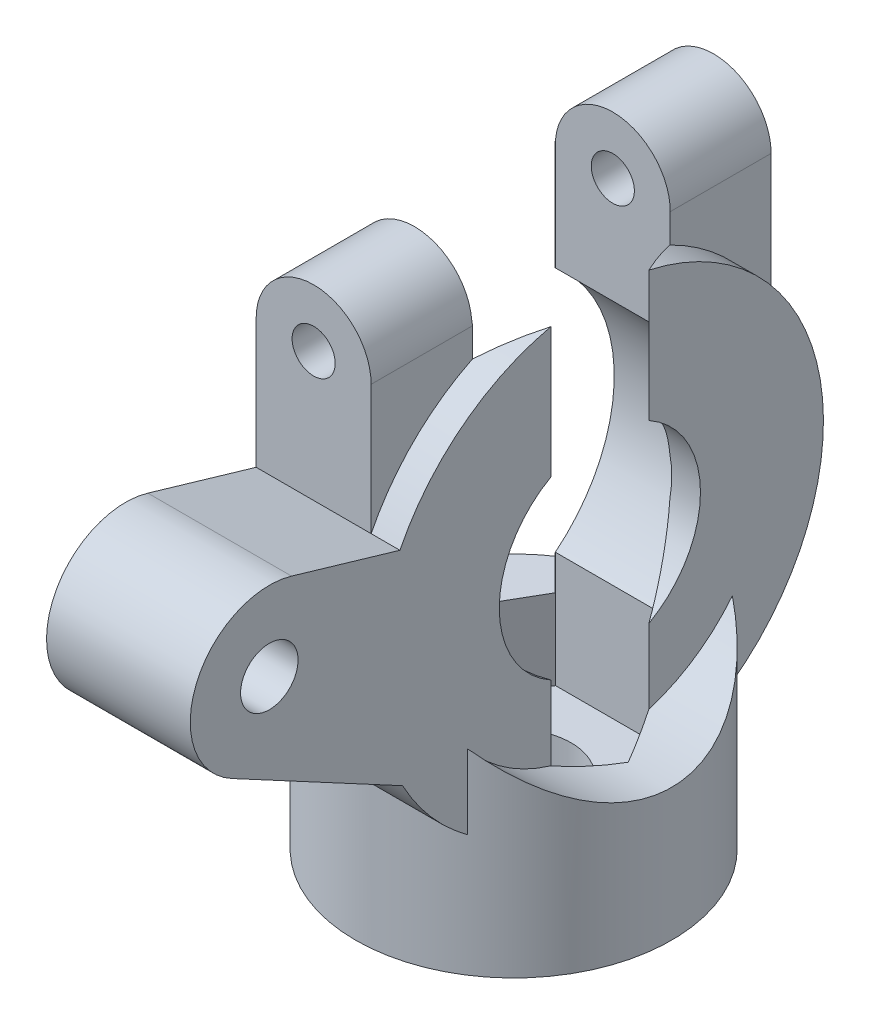
from build123d import *
from build123d.topology import SkipClean

# Parameters (mm, degrees)
SKETCH1_R               = 11
SKETCH1_R_2             = 4
BOSS_EXTRUDE1_DEPTH     = 10
SKETCH3_R               = 15.556349186
SKETCH3_R_2             = 11
BOSS_EXTRUDE2_DEPTH     = 4
CUT_EXTRUDE1_DEPTH      = 33.68393631
CUT_EXTRUDE1_DEPTH_BACK = 5.6
BOSS_EXTRUDE4_DEPTH     = 10
BOSS_EXTRUDE3_DEPTH     = 8
BOSS_EXTRUDE5_START     = 4
SKETCH3_2_R             = 15.556349186
SKETCH3_2_R_2           = 11
BOSS_EXTRUDE5_DEPTH     = 2
CUT_EXTRUDE2_DEPTH      = 37.349590584
CUT_EXTRUDE2_DEPTH_BACK = 5.6
CUT_EXTRUDE3_DEPTH      = 47.993816701
CUT_EXTRUDE3_DEPTH_BACK = 47.993816701
SKETCH13_R              = 7
CUT_EXTRUDE5_DEPTH      = 52.642447787
CUT_EXTRUDE5_DEPTH_BACK = 52.642447787
SKETCH14_R              = 1.5
SKETCH15_R              = 11.789942891
CUT_EXTRUDE6_DEPTH      = 8
BOSS_EXTRUDE6_REACH     = 48.308
SKETCH16_R              = 2


with BuildPart() as part:
    # Sketch1 → Boss-Extrude1 (new body)
    with BuildSketch(Plane(origin=(0, 0, 0), x_dir=(1, 0, 0), z_dir=(0, 1, 0))):
        with Locations(Location((0, 0, 0), (0, 0, 270))):
            Circle(SKETCH1_R)
        with Locations(Location((0, 0, 0), (0, 0, 270))):
            Circle(SKETCH1_R_2, mode=Mode.SUBTRACT)
    extrude(amount=BOSS_EXTRUDE1_DEPTH)

    # Sketch3 → Boss-Extrude2 (add, symmetric)
    with BuildSketch(Plane(origin=(0, 0, 0), x_dir=(0, 0, -1), z_dir=(1, 0, 0))):
        with Locations((0, 21)):
            Circle(SKETCH3_R)
        with Locations(Location((0, 21, 0), (0, 0, 270))):
            Circle(SKETCH3_R_2, mode=Mode.SUBTRACT)
    extrude(amount=BOSS_EXTRUDE2_DEPTH, both=True)

    # Sketch2 → Cut-Extrude1 (cut, two sides: drawn at the far end of the back side and taken through both)
    with BuildSketch(Plane(origin=(0, 10, 0), x_dir=(1, 0, 0), z_dir=(0, 1, 0)).offset(-CUT_EXTRUDE1_DEPTH_BACK)):
        Polygon((3.983716857, 6.9), (-3.983716857, 6.9), (-7.967433715, 0), (-3.983716857, -6.9), (3.983716857, -6.9), (7.967433715, 0), align=None)
    extrude(amount=CUT_EXTRUDE1_DEPTH + CUT_EXTRUDE1_DEPTH_BACK, mode=Mode.SUBTRACT)

    # Sketch9 → Boss-Extrude4 (add)
    with BuildSketch(Plane(origin=(0, 10, 0), x_dir=(1, 0, 0), z_dir=(0, 1, 0))):
        with BuildLine():
            ThreePointArc((4, -10.246950766), (11, 0), (4, 10.246950766))
            Line((4, 10.246950766), (4, 6.87179677))
            Line((4, 6.87179677), (7.967433715, 0))
            Line((7.967433715, 0), (4, -6.87179677))
            Line((4, -6.87179677), (4, -10.246950766))
        make_face()
    extrude(amount=BOSS_EXTRUDE4_DEPTH)

    # Sketch4 → Boss-Extrude3 (add)
    with BuildSketch(Plane(origin=(4, 0, 0), x_dir=(0, 0, -1), z_dir=(1, 0, 0))):
        with BuildLine():
            Line((-6.87179677, 34.956303563), (-6.87179677, 40.956303563))
            Line((-6.87179677, 40.956303563), (-13.914375327, 40.956303563))
            Line((-13.914375327, 40.956303563), (-13.914375327, 27.956303563))
            ThreePointArc((-13.914375327, 27.956303563), (-10.966596446, 32.033302425), (-6.87179677, 34.956303563))
        make_face()
        with BuildLine():
            Line((6.87179677, 34.956303563), (6.87179677, 40.956303563))
            Line((6.87179677, 40.956303563), (13.914375327, 40.956303563))
            Line((13.914375327, 40.956303563), (13.914375327, 27.956303563))
            ThreePointArc((13.914375327, 27.956303563), (10.966596446, 32.033302425), (6.87179677, 34.956303563))
        make_face()
    extrude(amount=-BOSS_EXTRUDE3_DEPTH)

    # Sketch3<2> → Boss-Extrude5 (add)
    # profile 1 of 2: a face of its own
    with SkipClean():  # the faces are left unmerged after this step: merging them gives an invalid solid
        with BuildSketch(Plane(origin=(0, 0, 0), x_dir=(0, 0, -1), z_dir=(1, 0, 0)).offset(BOSS_EXTRUDE5_START)):
            with Locations((0, 21)):
                Circle(SKETCH3_2_R)
            with Locations((0, 21)):
                Circle(SKETCH3_2_R_2, mode=Mode.SUBTRACT)
        # profile 2 of 2: a face of its own
        with BuildSketch(Plane(origin=(0, 0, 0), x_dir=(0, 0, -1), z_dir=(1, 0, 0)).offset(BOSS_EXTRUDE5_START)):
            with Locations((0, 21)):
                Circle(SKETCH3_2_R_2)
        extrude(amount=BOSS_EXTRUDE5_DEPTH)
    add(part.part.scale(1), mode=Mode.REPLACE)  # the faces are merged on a copy

    # Sketch2<2> → Cut-Extrude2 (cut, two sides: drawn at the far end of the back side and taken through both)
    with BuildSketch(Plane(origin=(0, 10, 0), x_dir=(1, 0, 0), z_dir=(0, 1, 0)).offset(-CUT_EXTRUDE2_DEPTH_BACK)):
        Polygon((3.983716857, 6.9), (-3.983716857, 6.9), (-7.967433715, 0), (-3.983716857, -6.9), (3.983716857, -6.9), (7.967433715, 0), align=None)
    extrude(amount=CUT_EXTRUDE2_DEPTH + CUT_EXTRUDE2_DEPTH_BACK, mode=Mode.SUBTRACT)

    # Sketch13 → Cut-Extrude3 (cut, two sides: drawn at the far end of the back side and taken through both)
    with BuildSketch(Plane(origin=(6, 0, 0), x_dir=(0, 0, -1), z_dir=(1, 0, 0)).offset(-CUT_EXTRUDE3_DEPTH_BACK)):
        with Locations((0, 21)):
            Circle(SKETCH13_R)
    extrude(amount=CUT_EXTRUDE3_DEPTH + CUT_EXTRUDE3_DEPTH_BACK, mode=Mode.SUBTRACT)

    # Sketch14 → Cut-Extrude5 (cut, two sides: drawn at the far end of the back side and taken through both)
    with BuildSketch(Plane.XY.offset(13.914375327).offset(-CUT_EXTRUDE5_DEPTH_BACK)):
        with Locations((0, 36.956303563)):
            Circle(SKETCH14_R)
        with BuildLine():
            Line((-4, 36.956303563), (-4, 43.473651887))
            Line((-4, 43.473651887), (4, 43.473651887))
            Line((4, 43.473651887), (4, 36.956303563))
            ThreePointArc((4, 36.956303563), (0, 40.956303563), (-4, 36.956303563))
        make_face()
    extrude(amount=CUT_EXTRUDE5_DEPTH + CUT_EXTRUDE5_DEPTH_BACK, mode=Mode.SUBTRACT)

    # Sketch15 → Cut-Extrude6 (cut)
    with BuildSketch(Plane(origin=(6, 0, 0), x_dir=(0, 0, -1), z_dir=(1, 0, 0))):
        with Locations((0, 21)):
            Circle(SKETCH15_R)
    extrude(amount=CUT_EXTRUDE6_DEPTH, mode=Mode.SUBTRACT)

    # Boss-Extrude6: up to this face of the body (flat: up to its plane)
    boss_extrude6_end = Plane(part.part.faces().sort_by_distance((6, 22.369931635, -9.227258585))[0])
    # Sketch16 → Boss-Extrude6 (add, up to the picked face)
    with BuildSketch(Plane.ZY.offset(4), mode=Mode.PRIVATE) as boss_extrude6_sk1:
        with BuildLine():
            Line((13.723567505, 13.674449171), (25.599337953, 20.043155389))
            ThreePointArc((25.599337953, 20.043155389), (28.089469493, 26.975176866), (21.451586712, 30.167697662))
            Line((21.451586712, 30.167697662), (13.914375327, 27.956303563))
            ThreePointArc((13.914375327, 27.956303563), (15.554961016, 20.792183273), (13.723567505, 13.674449171))
        make_face()
        with Locations((23, 24.890158814)):
            Circle(SKETCH16_R, mode=Mode.SUBTRACT)
    boss_extrude6_tool1 = split(extrude(boss_extrude6_sk1.sketch, amount=-BOSS_EXTRUDE6_REACH, mode=Mode.PRIVATE), bisect_by=boss_extrude6_end, keep=Keep.BOTH, mode=Mode.PRIVATE)
    add(boss_extrude6_tool1.solids().sort_by(Axis((-4, 23.412763, 20.74002), (1, 0, 0)))[0])


solid = part.part
